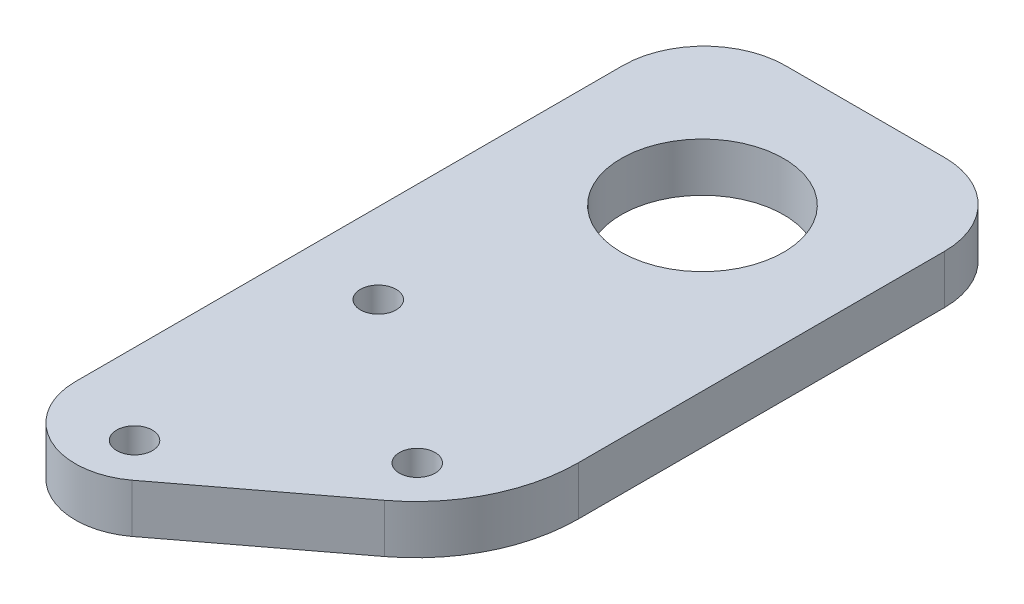
from build123d import *

# Parameters (mm, degrees)
SKETCH1_R           = 1.1
SKETCH1_R_2         = 5
BOSS_EXTRUDE1_DEPTH = 3


with BuildPart() as part:
    # Sketch1 → Boss-Extrude1 (new body)
    with BuildSketch(Plane(origin=(0, 0, 0), x_dir=(1, 0, 0), z_dir=(0, 1, 0))):
        with BuildLine():
            Line((-9.9, 27.5), (-9.9, -6.192201576))
            ThreePointArc((-9.9, -6.192201576), (-7.485730167, -10.104724514), (-2.905997097, -9.701512952))
            Line((-2.905997097, -9.701512952), (5.93857688, -3.001078121))
            ThreePointArc((5.93857688, -3.001078121), (8.855047984, 0.519324784), (9.9, 4.96984336))
            Line((9.9, 4.96984336), (9.9, 27.5))
            ThreePointArc((9.9, 27.5), (8.435533906, 31.035533906), (4.9, 32.5))
            Line((4.9, 32.5), (-4.9, 32.5))
            ThreePointArc((-4.9, 32.5), (-8.435533906, 31.035533906), (-9.9, 27.5))
        make_face()
        with Locations((-4.95, 7.5)):
            Circle(SKETCH1_R, mode=Mode.SUBTRACT)
        with Locations((-4.95, -7.5)):
            Circle(SKETCH1_R, mode=Mode.SUBTRACT)
        with Locations((4.95, 0)):
            Circle(SKETCH1_R, mode=Mode.SUBTRACT)
        with Locations((0, 22.5)):
            Circle(SKETCH1_R_2, mode=Mode.SUBTRACT)
    extrude(amount=BOSS_EXTRUDE1_DEPTH)


solid = part.part
